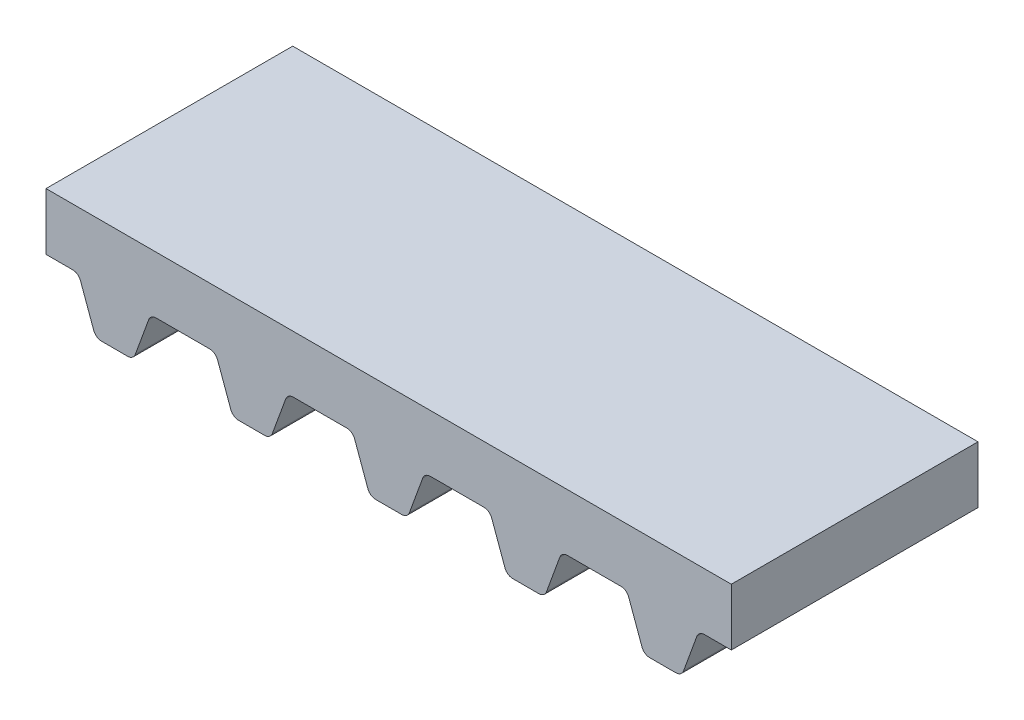
from build123d import *

# Parameters (mm, degrees)
BOSS_EXTRUDE1_DEPTH    = 4.5
FILLET1_R              = 0.3
LPATTERN1_COUNT        = 5
LPATTERN1_PITCH        = 5
FILLET1_OF_LPATTERN1_R = 0.3


with BuildPart() as part:
    # Sketch1 → Boss-Extrude1 (new, symmetric)
    with BuildSketch(Plane.XY):
        Polygon((0, 0), (5, 0), (5, -2.08), (3.814834253, -2.08), (3.185165747, -3.81), (1.814834253, -3.81), (1.185165747, -2.08), (0, -2.08), align=None)
    boss_extrude1 = extrude(amount=BOSS_EXTRUDE1_DEPTH, both=True)

    # Fillet1
    fillet1_edges = [part.edges().sort_by_distance(p)[0] for p in [
        (1.814834253, -3.81, 0),
        (1.185165747, -2.08, 0),
        (3.185165747, -3.81, 0),
        (3.814834253, -2.08, 0),
    ]]
    fillet(fillet1_edges, radius=FILLET1_R)

    # LPattern1: Boss-Extrude1 ×5
    with Locations(*[(i * LPATTERN1_PITCH, 0, 0) for i in range(1, LPATTERN1_COUNT)]):
        add(boss_extrude1)

    # Fillet1 of LPattern1
    fillet1_of_lpattern1_edges = [part.edges().sort_by_distance(p)[0] for p in [
        (6.814834253, -3.81, 0),
        (6.185165747, -2.08, 0),
        (8.185165747, -3.81, 0),
        (8.814834253, -2.08, 0),
        (11.814834253, -3.81, 0),
        (11.185165747, -2.08, 0),
        (13.185165747, -3.81, 0),
        (13.814834253, -2.08, 0),
        (16.814834253, -3.81, 0),
        (16.185165747, -2.08, 0),
        (18.185165747, -3.81, 0),
        (18.814834253, -2.08, 0),
        (21.814834253, -3.81, 0),
        (21.185165747, -2.08, 0),
        (23.185165747, -3.81, 0),
        (23.814834253, -2.08, 0),
    ]]
    fillet(fillet1_of_lpattern1_edges, radius=FILLET1_OF_LPATTERN1_R)


solid = part.part
